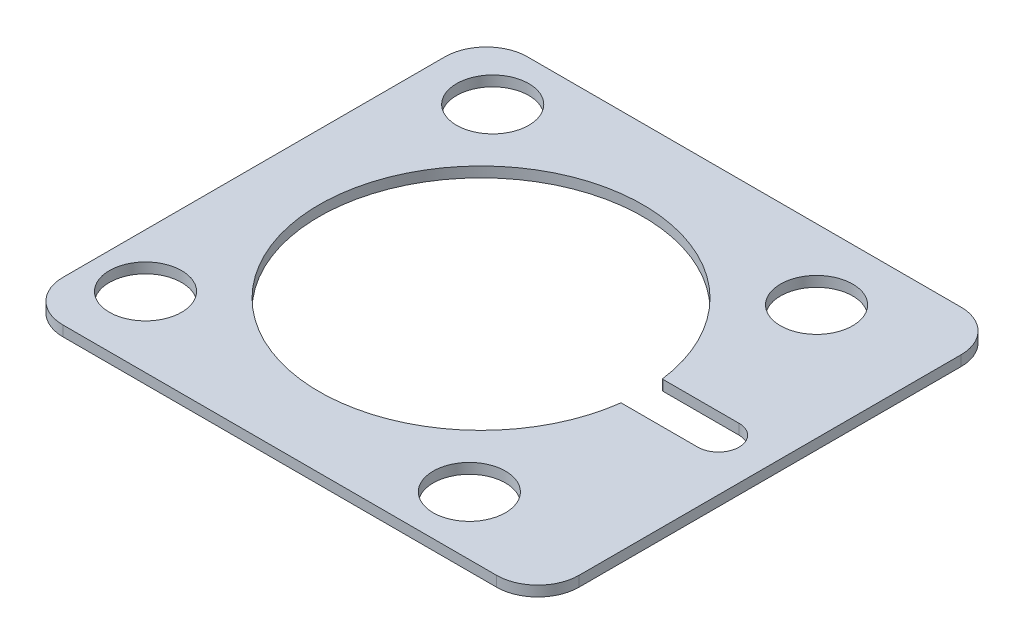
from build123d import *

# Parameters (mm, degrees)
SKETCH1_R           = 1.75
BOSS_EXTRUDE1_DEPTH = 0.5


with BuildPart() as part:
    # Sketch1 → Boss-Extrude1 (new body)
    with BuildSketch(Plane(origin=(0, 0, 0), x_dir=(1, 0, 0), z_dir=(0, 1, 0))):
        with BuildLine():
            Line((-10.5, -11.25), (10.5, -11.25))
            ThreePointArc((10.5, -11.25), (11.914213562, -10.664213562), (12.5, -9.25))
            Line((12.5, -9.25), (12.5, 9.25))
            ThreePointArc((12.5, 9.25), (11.914213562, 10.664213562), (10.5, 11.25))
            Line((10.5, 11.25), (-10.5, 11.25))
            ThreePointArc((-10.5, 11.25), (-11.914213562, 10.664213562), (-12.5, 9.25))
            Line((-12.5, 9.25), (-12.5, -9.25))
            ThreePointArc((-12.5, -9.25), (-11.914213562, -10.664213562), (-10.5, -11.25))
        make_face()
        with Locations((-9.344009468, 8.409608521)):
            Circle(SKETCH1_R, mode=Mode.SUBTRACT)
        with Locations((-9.909608521, -7.844009468)):
            Circle(SKETCH1_R, mode=Mode.SUBTRACT)
        with Locations((6.344009468, -8.409608521)):
            Circle(SKETCH1_R, mode=Mode.SUBTRACT)
        with Locations((6.909608521, 7.844009468)):
            Circle(SKETCH1_R, mode=Mode.SUBTRACT)
        with BuildLine():
            Line((10, -1), (6.344009468, -1))
            ThreePointArc((6.344009468, -1), (6.312121796, -0.999491459), (6.280266556, -0.997966353))
            ThreePointArc((6.280266556, -0.997966353), (-9.344009468, 0), (6.280266556, 0.997966353))
            ThreePointArc((6.280266556, 0.997966353), (6.312121796, 0.999491459), (6.344009468, 1))
            Line((6.344009468, 1), (10, 1))
            ThreePointArc((10, 1), (11, 0), (10, -1))
        make_face(mode=Mode.SUBTRACT)
    extrude(amount=BOSS_EXTRUDE1_DEPTH)


solid = part.part
